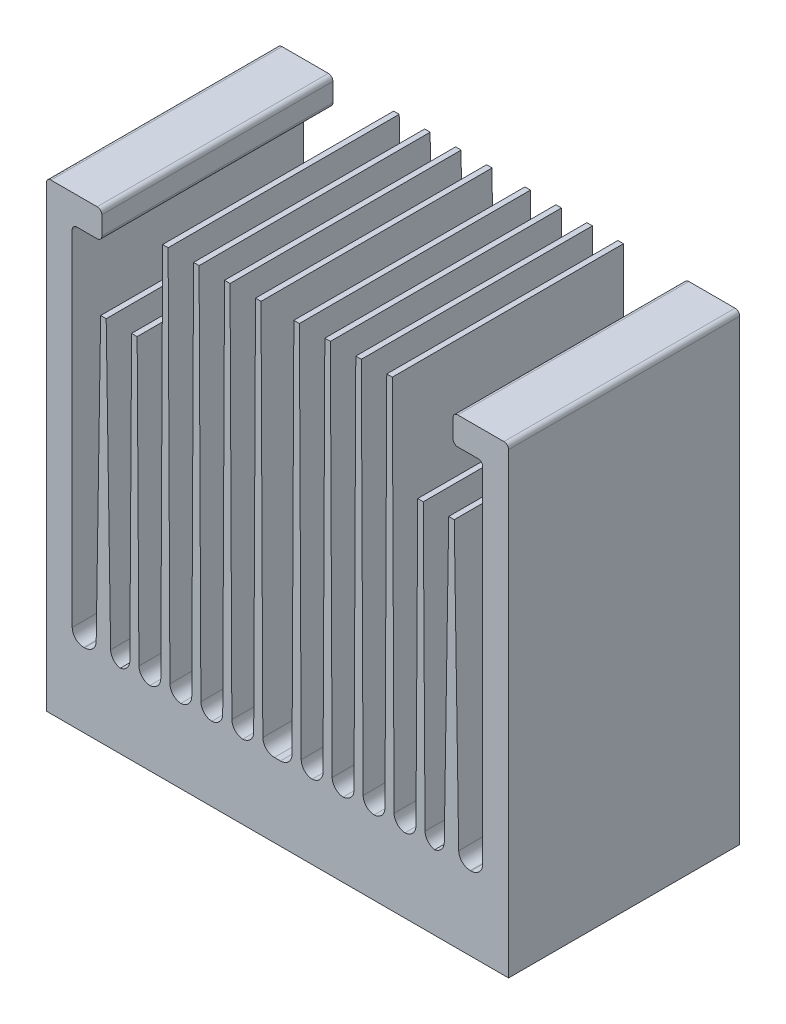
from build123d import *

# Parameters (mm, degrees)
SKETCH_1_W          = 50
SKETCH_1_H          = 25
EXTRUDE_1_DEPTH     = 50
CUT_EXTRUDE_3_DEPTH = 62.23724357
FILLET_1_R          = 1.25
FILLET_2_R          = 0.5


with BuildPart() as part:
    # 草图1 → 拉伸1 (new body)
    with BuildSketch(Plane(origin=(0, 0, 0), x_dir=(1, 0, 0), z_dir=(0, 1, 0))):
        Rectangle(SKETCH_1_W, SKETCH_1_H)
    extrude(amount=EXTRUDE_1_DEPTH)

    # 草图3 → 切除-拉伸3 (cut, through all)
    with BuildSketch(Plane(origin=(0, 0, -12.5), x_dir=(-1, 0, 0), z_dir=(0, 0, -1))):
        Polygon((-19, 50), (-19, 47), (-22.2, 47), (-22.2, 8), (-19.625, 8), (-19.125, 40), (-18.525, 40), (-18.025, 8), (-15.975, 8), (-15.775, 40), (-15.175, 40), (-14.975, 8), (-12.625, 8), (-12.425, 50), (-11.825, 50), (-11.625, 8), (-9.275, 8), (-9.075, 50), (-8.475, 50), (-8.275, 8), (-5.925, 8), (-5.725, 50), (-5.125, 50), (-4.925, 8), (-2.575, 8), (-2.375, 50), (-1.775, 50), (-1.575, 8), (1.575, 8), (1.775, 50), (2.375, 50), (2.575, 8), (4.925, 8), (5.125, 50), (5.725, 50), (5.925, 8), (8.275, 8), (8.475, 50), (9.075, 50), (9.275, 8), (11.625, 8), (11.825, 50), (12.425, 50), (12.625, 8), (14.975, 8), (15.175, 40), (15.775, 40), (15.975, 8), (18.025, 8), (18.525, 40), (19.125, 40), (19.625, 8), (22.2, 8), (22.2, 47), (19, 47), (19, 50), (19, 55.346255007), (-19, 55.346255007), align=None)
    extrude(amount=-CUT_EXTRUDE_3_DEPTH, mode=Mode.SUBTRACT)

    # 圆角1
    # the kernel refuses this fillet: 1.25 mm, written as the material it adds along each edge
    with BuildSketch(Plane(origin=(-2.575, 8, -12.5), x_dir=(0.004761850772972935, 0.9999886623243365, 0), z_dir=(0, 0, 1)), Plane(origin=(-1.575, 8, -12.5), x_dir=(1, 0, 0), z_dir=(0, 0, 1)), Plane(origin=(1.575, 8, -12.5), x_dir=(0.004761850772973114, 0.9999886623243365, 0), z_dir=(0, 0, 1)), Plane(origin=(2.575, 8, -12.5), x_dir=(1, 0, 0), z_dir=(0, 0, 1)), Plane(origin=(4.925, 8, -12.5), x_dir=(0.004761850772972935, 0.9999886623243365, 0), z_dir=(0, 0, 1)), Plane(origin=(5.925, 8, -12.5), x_dir=(1, 0, 0), z_dir=(0, 0, 1)), Plane(origin=(8.275, 8, -12.5), x_dir=(0.004761850772972963, 0.9999886623243365, 0), z_dir=(0, 0, 1)), Plane(origin=(9.275, 8, -12.5), x_dir=(1, 0, 0), z_dir=(0, 0, 1)), Plane(origin=(11.625, 8, -12.5), x_dir=(0.004761850772972963, 0.9999886623243365, 0), z_dir=(0, 0, 1)), Plane(origin=(12.625, 8, -12.5), x_dir=(1, 0, 0), z_dir=(0, 0, 1)), Plane(origin=(-12.625, 8, -12.5), x_dir=(0.004761850772972963, 0.9999886623243365, 0), z_dir=(0, 0, 1)), Plane(origin=(-11.625, 8, -12.5), x_dir=(1, 0, 0), z_dir=(0, 0, 1)), Plane(origin=(-9.275, 8, -12.5), x_dir=(0.004761850772972963, 0.9999886623243365, 0), z_dir=(0, 0, 1)), Plane(origin=(-8.275, 8, -12.5), x_dir=(1, 0, 0), z_dir=(0, 0, 1)), Plane(origin=(-5.925, 8, -12.5), x_dir=(0.004761850772972935, 0.9999886623243365, 0), z_dir=(0, 0, 1)), Plane(origin=(-4.925, 8, -12.5), x_dir=(1, 0, 0), z_dir=(0, 0, 1))) as fillet_1_piece_1:
        with BuildLine():
            CenterArc((FILLET_1_R * 0.995249433042, FILLET_1_R), FILLET_1_R, 180.272834983, 89.727165017)
            Line((-FILLET_1_R * 0.00473922928203, FILLET_1_R * 0.995238149227), (0, 0))
            Line((0, 0), (FILLET_1_R * 0.995249433042, 0))
        make_face()
    extrude(amount=25)
    with BuildSketch(Plane(origin=(14.975, 8, -12.5), x_dir=(0.006249877933264038, 0.999980469322186, 0), z_dir=(0, 0, 1)), Plane(origin=(15.975, 8, -12.5), x_dir=(1, 0, 0), z_dir=(0, 0, 1)), Plane(origin=(-15.975, 8, -12.5), x_dir=(0.00624987793326402, 0.999980469322186, 0), z_dir=(0, 0, 1)), Plane(origin=(-14.975, 8, -12.5), x_dir=(1, 0, 0), z_dir=(0, 0, 1))) as fillet_1_piece_2:
        with BuildLine():
            CenterArc((FILLET_1_R * 0.993769531059, FILLET_1_R), FILLET_1_R, 180.358093959, 89.641906041)
            Line((-FILLET_1_R * 0.00621093826293, FILLET_1_R * 0.993750122067), (0, 0))
            Line((0, 0), (FILLET_1_R * 0.993769531059, 0))
        make_face()
    extrude(amount=25)
    with BuildSketch(Plane(origin=(18.025, 8, -12.5), x_dir=(0.015623093000541032, 0.9998779520346953, 0), z_dir=(0, 0, 1)), Plane(origin=(19.625, 8, -12.5), x_dir=(1, 0, 0), z_dir=(0, 0, 1)), Plane(origin=(-19.625, 8, -12.5), x_dir=(0.015623093000541032, 0.9998779520346953, 0), z_dir=(0, 0, 1)), Plane(origin=(-18.025, 8, -12.5), x_dir=(1, 0, 0), z_dir=(0, 0, 1))) as fillet_1_piece_3:
        with BuildLine():
            CenterArc((FILLET_1_R * 0.984497062863, FILLET_1_R), FILLET_1_R, 180.89517371, 89.10482629)
            Line((-FILLET_1_R * 0.0153808891719, FILLET_1_R * 0.984376906999), (0, 0))
            Line((0, 0), (FILLET_1_R * 0.984497062863, 0))
        make_face()
    extrude(amount=25)
    with BuildSketch(Plane(origin=(22.2, 8, -12.5), x_dir=(0, 1, 0), z_dir=(0, 0, 1)), Plane(origin=(-22.2, 8, -12.5), x_dir=(1, 0, 0), z_dir=(0, 0, 1))) as fillet_1_piece_4:
        with BuildLine():
            CenterArc((FILLET_1_R, FILLET_1_R), FILLET_1_R, 180, 90)
            Line((0, FILLET_1_R), (0, 0))
            Line((0, 0), (FILLET_1_R, 0))
        make_face()
    extrude(amount=25)

    # 圆角2
    fillet_2_edges = [part.edges().sort_by_distance(p)[0] for p in [
        (25, 50, 0),
        (22.2, 47, 0),
        (19, 47, 0),
        (19, 50, 0),
        (-19, 50, 0),
        (-25, 50, 0),
        (-19, 47, 0),
        (-22.2, 47, 0),
    ]]
    fillet(fillet_2_edges, radius=FILLET_2_R)


solid = part.part
